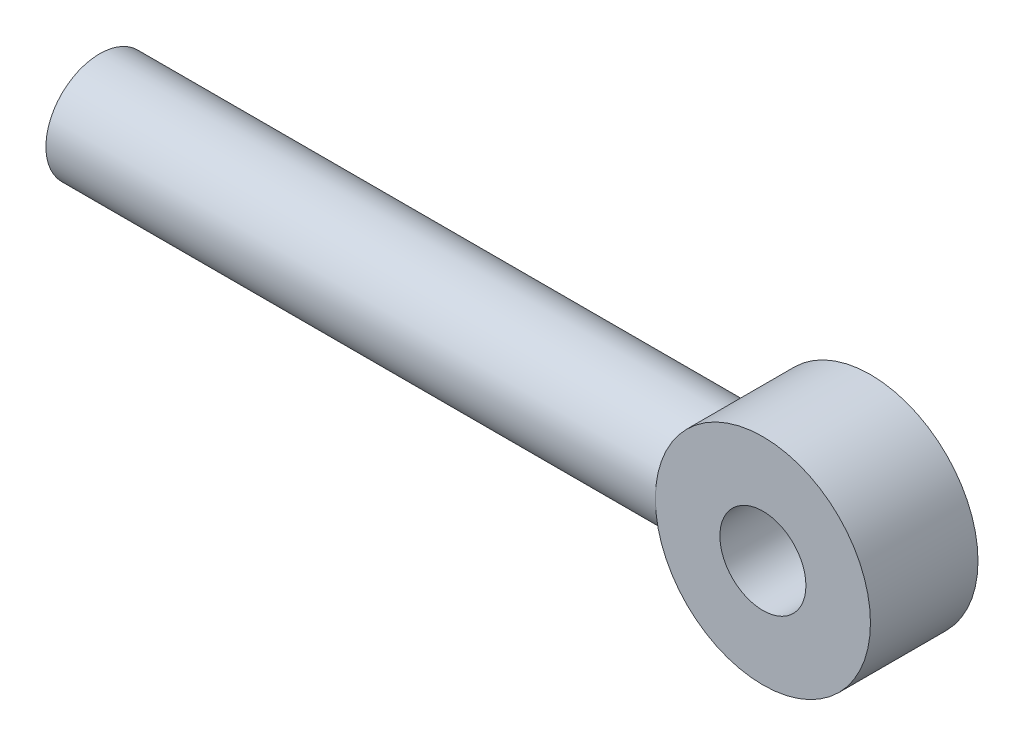
from build123d import *
from build123d.topology import SkipClean

# Parameters (mm, degrees)
SKETCH1_R                = 0.75
BOSS_EXTRUDE1_DEPTH      = 10
BOSS_EXTRUDE2_DEPTH      = 0.75
BOSS_EXTRUDE2_DEPTH_BACK = 0.75
SKETCH2_R                = 1.5
SKETCH3_R                = 0.6
CUT_EXTRUDE1_DEPTH       = 1.5


with BuildPart() as part:
    # Sketch1 → Boss-Extrude1 (new body)
    with BuildSketch(Plane(origin=(0, 0, 0), x_dir=(0, 0, -1), z_dir=(1, 0, 0))):
        Circle(SKETCH1_R)
    extrude(amount=BOSS_EXTRUDE1_DEPTH)

    # Sketch2 → Boss-Extrude2 (add, two sides: drawn at the far end of the back side and taken through both)
    with SkipClean():  # the faces are left unmerged after this step: merging them gives an invalid solid
        with BuildSketch(Plane.XY.offset(-BOSS_EXTRUDE2_DEPTH_BACK)):
            with Locations((10, 0)):
                Circle(SKETCH2_R)
        extrude(amount=BOSS_EXTRUDE2_DEPTH + BOSS_EXTRUDE2_DEPTH_BACK)

    # Sketch3 → Cut-Extrude1 (cut)
    with SkipClean():  # the faces are left unmerged after this step: merging them gives an invalid solid
        with BuildSketch(Plane.XY.offset(0.75)):
            with Locations((10, 0)):
                Circle(SKETCH3_R)
        extrude(amount=-CUT_EXTRUDE1_DEPTH, mode=Mode.SUBTRACT)


solid = part.part
